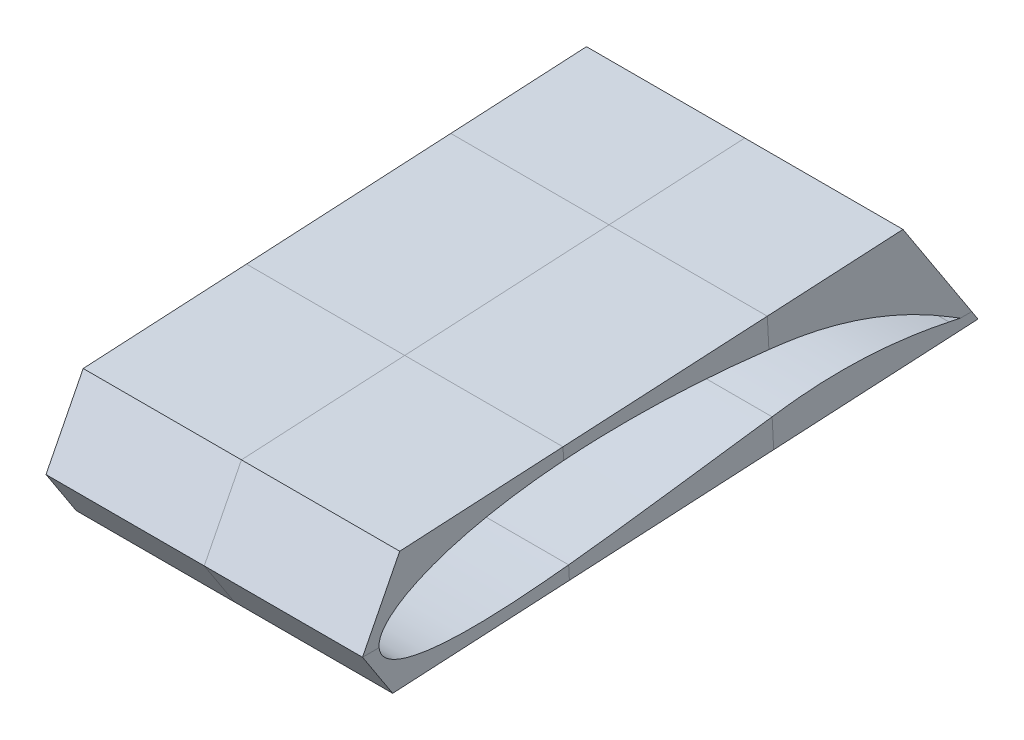
from build123d import *

# Parameters (mm, degrees)
BOSS_EXTRUDE1_DEPTH = 307.975
SPLIT1_START        = -485.775
SPLIT1_DEPTH        = 153.9875
SPLIT1_2_DEPTH      = 307.975
SPLIT1_3_DEPTH      = 153.9875
SPLIT1_START_2      = -331.7875
SPLIT1_4_DEPTH      = 153.9875
SPLIT1_5_DEPTH      = 153.9875
SPLIT1_6_DEPTH      = 153.9875
SPLIT1_7_DEPTH      = 153.9875
SPLIT1_8_DEPTH      = 153.9875
SPLIT1_9_DEPTH      = 153.9875
SPLIT1_10_DEPTH     = 153.9875
SPLIT1_11_DEPTH     = 153.9875
SPLIT1_12_DEPTH     = 153.9875
SPLIT1_13_DEPTH     = 153.9875


# Read off the part's stored shape, not the designer's step: Split1
with BuildPart() as part:
    # Sketch1 → Boss-Extrude1 (new body)
    with BuildSketch(Plane(origin=(-177.8, 0, 0), x_dir=(0, 0, -1), z_dir=(1, 0, 0))):
        Polygon((513.02494952, -19.851775639), (-56.509600677, -50.472242358), (-85.881394641, -5.377282109), (-49.696241189, 65.878150842), (440.036717188, 92.208163215), align=None)
        with BuildLine():
            Line((484.839703056, -8.192197373), (495.8122137, -10.532748432))
            Line((495.8122137, -10.532748432), (486.265240326, -4.635043727))
            add(Edge.make_bspline(
                [(486.265240326, -4.635043727), (475.79860462, 1.830788345), (454.312764269, 13.889269748), (420.690900196, 29.224509239), (391.639559872, 39.466297596), (367.90681192, 46.038347186), (349.897665028, 50.128971617), (331.712828112, 53.395898866), (313.408651411, 55.714700607), (295.107197371, 57.867272502), (270.654519927, 60.351467104), (240.02755424, 62.792086284), (203.195919164, 64.551841288), (166.320848878, 65.028496228), (129.448182964, 64.061858785), (92.64737896, 61.427213177), (62.127891062, 57.590313265), (37.896239171, 53.299755101), (19.852790085, 49.385506886), (1.994982658, 44.66024218), (-12.661714378, 39.910938035), (-24.174367926, 35.489238489), (-32.668724275, 31.808428386), (-40.974488962, 27.691854794), (-49.012685713, 23.031932392), (-56.633939597, 17.658079271), (-62.404116233, 12.345324832), (-66.27011402, 7.327354834), (-68.571498001, 3.099417508), (-69.561010993, -0.452354777), (-69.791797127, -2.884453105), (-69.817628559, -4.125270626), (-69.719695431, -5.366591547), (-69.617591835, -6.130019587), (-69.566361774, -6.519139071)],
                knots=[0, 0, 0, 0, 0.062504124, 0.125008247, 0.187512371, 0.218764432, 0.250016494, 0.281268556, 0.312520618, 0.343772679, 0.375024741, 0.437528865, 0.500032988, 0.562537112, 0.625041235, 0.687545359, 0.750049482, 0.781301544, 0.812553606, 0.843805668, 0.87505773, 0.89068376, 0.906309791, 0.921935822, 0.937561853, 0.953187884, 0.968813915, 0.97662693, 0.984439946, 0.992252961, 0.994206215, 0.996159469, 0.998112723, 1.000065977, 1.000065977, 1.000065977, 1.000065977], degree=3))
            add(Edge.make_bspline(
                [(-69.566361774, -6.519139071), (-69.488391083, -6.887212733), (-69.336376013, -7.610527586), (-69.035422589, -8.761843268), (-68.626070204, -9.882594068), (-67.661985103, -12.02122893), (-65.692313013, -14.954602026), (-62.34121882, -18.137449476), (-57.338218927, -21.596487635), (-50.522049924, -24.79036297), (-42.005913899, -27.535977551), (-33.324040008, -29.551342566), (-21.635201556, -31.532992145), (-6.913441025, -33.018600841), (10.797287334, -33.77654236), (28.509731195, -33.795049142), (46.204386524, -33.258608838), (69.764194558, -31.966919449), (99.146019739, -29.503407621), (134.308212308, -25.693371562), (169.399514795, -21.349054953), (204.44646442, -16.703884826), (239.471434512, -11.928812283), (268.654643905, -7.939420679), (292.007732636, -4.791722901), (306.600292673, -2.837801001), (318.28899772, -1.309074367), (329.949567815, 0.263068832), (344.57029527, 1.719295513), (362.175990442, 2.805066666), (385.687405297, 3.31793184), (415.082460118, 2.25388388), (444.321872592, -0.96022194), (467.54212674, -4.727772579), (479.089279042, -6.965571904), (484.839703056, -8.192197373)],
                knots=[-6.8756e-05, -6.8756e-05, -6.8756e-05, -6.8756e-05, 0.001884504, 0.003837763, 0.005791022, 0.007744282, 0.015557319, 0.023370356, 0.031183393, 0.046809467, 0.062435542, 0.078061616, 0.09368769, 0.124939839, 0.156191987, 0.187444136, 0.218696285, 0.249948433, 0.312452731, 0.374957028, 0.437461325, 0.499965622, 0.562469919, 0.624974217, 0.656226365, 0.687478514, 0.703104588, 0.718730662, 0.749982811, 0.78123496, 0.812487108, 0.874991406, 0.937495703, 0.968747851, 1, 1, 1, 1], degree=3))
        make_face(mode=Mode.SUBTRACT)
    extrude(amount=-BOSS_EXTRUDE1_DEPTH)

    # Split1 2 outline → Split1 2 (cut)
    with BuildSketch(Plane.YZ.offset(SPLIT1_START)):
        with BuildLine():
            Line((-19.851775639, -513.02494952), (-10.532748431, -506.955168206))
            Line((-10.532748431, -506.955168206), (-10.532748432, -495.8122137))
            Line((-10.532748432, -495.8122137), (-8.192197373, -484.839703056))
            add(Edge.make_bspline(
                [(-6.519139071, 69.566361774), (-6.887212733, 69.488391083), (-7.610527586, 69.336376013), (-8.761843268, 69.035422589), (-9.882594068, 68.626070204), (-12.02122893, 67.661985103), (-14.954602026, 65.692313013), (-18.137449476, 62.34121882), (-21.596487635, 57.338218927), (-24.79036297, 50.522049924), (-27.535977551, 42.005913899), (-29.551342566, 33.324040008), (-31.532992145, 21.635201556), (-33.018600841, 6.913441025), (-33.77654236, -10.797287334), (-33.795049142, -28.509731195), (-33.258608838, -46.204386524), (-31.966919449, -69.764194558), (-29.503407621, -99.146019739), (-25.693371562, -134.308212308), (-21.349054953, -169.399514795), (-16.703884826, -204.44646442), (-11.928812283, -239.471434512), (-7.939420679, -268.654643905), (-4.791722901, -292.007732636), (-2.837801001, -306.600292673), (-1.309074367, -318.28899772), (0.263068832, -329.949567815), (1.719295513, -344.57029527), (2.805066666, -362.175990442), (3.31793184, -385.687405297), (2.25388388, -415.082460118), (-0.96022194, -444.321872592), (-4.727772579, -467.54212674), (-6.965571904, -479.089279042), (-8.192197373, -484.839703056)],
                knots=[-6.8756e-05, -6.8756e-05, -6.8756e-05, -6.8756e-05, 0.001884504, 0.003837763, 0.005791022, 0.007744282, 0.015557319, 0.023370356, 0.031183393, 0.046809467, 0.062435542, 0.078061616, 0.09368769, 0.124939839, 0.156191987, 0.187444136, 0.218696285, 0.249948433, 0.312452731, 0.374957028, 0.437461325, 0.499965622, 0.562469919, 0.624974217, 0.656226365, 0.687478514, 0.703104588, 0.718730662, 0.749982811, 0.78123496, 0.812487108, 0.874991406, 0.937495703, 0.968747851, 1, 1, 1, 1], degree=3))
            add(Edge.make_bspline(
                [(56.152986063, -309.562582286), (56.731683742, -304.743730709), (57.997792096, -293.822453609), (60.351467104, -270.654519927), (62.792086284, -240.02755424), (64.551841288, -203.195919164), (65.028496228, -166.320848878), (64.061858785, -129.448182964), (61.427213177, -92.64737896), (57.590313265, -62.127891062), (53.299755101, -37.896239171), (49.385506886, -19.852790085), (44.66024218, -1.994982658), (39.910938035, 12.661714378), (35.489238489, 24.174367926), (31.808428386, 32.668724275), (27.691854794, 40.974488962), (23.031932392, 49.012685713), (17.658079271, 56.633939597), (12.345324832, 62.404116233), (7.327354834, 66.27011402), (3.099417508, 68.571498001), (-0.452354777, 69.561010993), (-2.884453105, 69.791797127), (-4.125270626, 69.817628559), (-5.366591547, 69.719695431), (-6.130019587, 69.617591835), (-6.519139071, 69.566361774)],
                knots=[0.319088551, 0.319088551, 0.319088551, 0.319088551, 0.343772679, 0.375024741, 0.437528865, 0.500032988, 0.562537112, 0.625041235, 0.687545359, 0.750049482, 0.781301544, 0.812553606, 0.843805668, 0.87505773, 0.89068376, 0.906309791, 0.921935822, 0.937561853, 0.953187884, 0.968813915, 0.97662693, 0.984439946, 0.992252961, 0.994206215, 0.996159469, 0.998112723, 1.000065977, 1.000065977, 1.000065977, 1.000065977], degree=3))
            Line((56.152986063, -309.562582286), (85.109648016, -308.005755745))
            Line((85.109648016, -308.005755745), (65.878150842, 49.696241189))
            Line((65.878150842, 49.696241189), (-5.377282109, 85.881394641))
            Line((-5.377282109, 85.881394641), (-50.472242358, 56.509600677))
            Line((-50.472242358, 56.509600677), (-19.851775639, -513.02494952))
        make_face()
    extrude(amount=SPLIT1_2_DEPTH, mode=Mode.SUBTRACT)

    # Split1 3 outline → Split1 3 (cut)
    with BuildSketch(Plane.YZ.offset(SPLIT1_START)):
        with BuildLine():
            Line((-10.532748432, -495.8122137), (-10.532748432, -506.955168205))
            Line((-10.532748432, -506.955168205), (92.208163215, -440.036717188))
            Line((92.208163215, -440.036717188), (85.109648016, -308.005755745))
            Line((85.109648016, -308.005755745), (56.152986063, -309.562582286))
            add(Edge.make_bspline(
                [(-4.635043727, -486.265240326), (1.830788345, -475.79860462), (13.889269748, -454.312764269), (29.224509239, -420.690900196), (39.466297596, -391.639559872), (46.038347186, -367.90681192), (50.128971617, -349.897665028), (53.395898866, -331.712828112), (55.104206496, -318.227774964), (55.99900663, -310.8447786), (56.152986063, -309.562582286)],
                knots=[0, 0, 0, 0, 0.062504124, 0.125008247, 0.187512371, 0.218764432, 0.250016494, 0.281268556, 0.312520618, 0.319088551, 0.319088551, 0.319088551, 0.319088551], degree=3))
            Line((-4.635043727, -486.265240326), (-10.532748432, -495.8122137))
        make_face()
    extrude(amount=SPLIT1_3_DEPTH, mode=Mode.SUBTRACT)


with BuildPart() as body_2:
    # Split1 outline → Split1 (new body)
    with BuildSketch(Plane.YZ.offset(SPLIT1_START)):
        with BuildLine():
            add(Edge.make_bspline(
                [(56.152986063, -309.562582286), (56.731683742, -304.743730709), (57.997792096, -293.822453609), (60.351467104, -270.654519927), (62.792086284, -240.02755424), (64.551841288, -203.195919164), (65.028496228, -166.320848878), (64.212349164, -135.188682185), (63.065132011, -116.375549157), (62.579717542, -109.841009626)],
                knots=[0.319088551, 0.319088551, 0.319088551, 0.319088551, 0.343772679, 0.375024741, 0.437528865, 0.500032988, 0.562537112, 0.625041235, 0.658352606, 0.658352606, 0.658352606, 0.658352606], degree=3))
            Line((56.152986063, -309.562582286), (85.109648016, -308.005755745))
            Line((85.109648016, -308.005755745), (74.421285843, -109.204359323))
            Line((74.421285843, -109.204359323), (62.579717542, -109.841009626))
        make_face()
    extrude(amount=SPLIT1_DEPTH)


with BuildPart() as body_3:
    # Split1 4 outline → Split1 4 (new body)
    with BuildSketch(Plane.YZ.offset(SPLIT1_START_2)):
        with BuildLine():
            Line((-2.041680646, -312.691361488), (-30.540137813, -314.223553097))
            Line((-30.540137813, -314.223553097), (-19.851775639, -513.02494952))
            Line((-19.851775639, -513.02494952), (-10.532748432, -506.955168205))
            Line((-10.532748432, -506.955168205), (-10.532748432, -495.8122137))
            Line((-10.532748432, -495.8122137), (-8.192197373, -484.839703056))
            add(Edge.make_bspline(
                [(-2.041680646, -312.691361488), (-1.796442631, -314.556679466), (-1.167008044, -319.342702191), (0.263068832, -329.949567815), (1.719295513, -344.57029527), (2.805066666, -362.175990442), (3.31793184, -385.687405297), (2.25388388, -415.082460118), (-0.96022194, -444.321872592), (-4.727772579, -467.54212674), (-6.965571904, -479.089279042), (-8.192197373, -484.839703056)],
                knots=[0.693126699, 0.693126699, 0.693126699, 0.693126699, 0.703104588, 0.718730662, 0.749982811, 0.78123496, 0.812487108, 0.874991406, 0.937495703, 0.968747851, 1, 1, 1, 1], degree=3))
        make_face()
    extrude(amount=SPLIT1_4_DEPTH)


with BuildPart() as body_4:
    # Split1 5 outline → Split1 5 (new body)
    with BuildSketch(Plane.YZ.offset(SPLIT1_START)):
        with BuildLine():
            Line((-10.532748432, -495.8122137), (-10.532748432, -506.955168205))
            Line((-10.532748432, -506.955168205), (92.208163215, -440.036717188))
            Line((92.208163215, -440.036717188), (85.109648016, -308.005755745))
            Line((85.109648016, -308.005755745), (56.152986063, -309.562582286))
            add(Edge.make_bspline(
                [(-4.635043727, -486.265240326), (1.830788345, -475.79860462), (13.889269748, -454.312764269), (29.224509239, -420.690900196), (39.466297596, -391.639559872), (46.038347186, -367.90681192), (50.128971617, -349.897665028), (53.395898866, -331.712828112), (55.104206496, -318.227774964), (55.99900663, -310.8447786), (56.152986063, -309.562582286)],
                knots=[0, 0, 0, 0, 0.062504124, 0.125008247, 0.187512371, 0.218764432, 0.250016494, 0.281268556, 0.312520618, 0.319088551, 0.319088551, 0.319088551, 0.319088551], degree=3))
            Line((-4.635043727, -486.265240326), (-10.532748432, -495.8122137))
        make_face()
    extrude(amount=SPLIT1_5_DEPTH)


with BuildPart() as body_5:
    # Split1 6 outline → Split1 6 (new body)
    with BuildSketch(Plane.YZ.offset(SPLIT1_START_2)):
        with BuildLine():
            Line((-41.228499986, -115.422156675), (-27.785316045, -114.699397075))
            add(Edge.make_bspline(
                [(-6.519139071, 69.566361774), (-6.887212733, 69.488391083), (-7.610527586, 69.336376013), (-8.761843268, 69.035422589), (-9.882594068, 68.626070204), (-12.02122893, 67.661985103), (-14.954602026, 65.692313013), (-18.137449476, 62.34121882), (-21.596487635, 57.338218927), (-24.79036297, 50.522049924), (-27.535977551, 42.005913899), (-29.551342566, 33.324040008), (-31.532992145, 21.635201556), (-33.018600841, 6.913441025), (-33.77654236, -10.797287334), (-33.795049142, -28.509731195), (-33.258608838, -46.204386524), (-31.966919449, -69.764194558), (-30.052829509, -92.593172025), (-28.335360098, -109.512495123), (-27.785316045, -114.699397075)],
                knots=[-6.8756e-05, -6.8756e-05, -6.8756e-05, -6.8756e-05, 0.001884504, 0.003837763, 0.005791022, 0.007744282, 0.015557319, 0.023370356, 0.031183393, 0.046809467, 0.062435542, 0.078061616, 0.09368769, 0.124939839, 0.156191987, 0.187444136, 0.218696285, 0.249948433, 0.312452731, 0.340107156, 0.340107156, 0.340107156, 0.340107156], degree=3))
            add(Edge.make_bspline(
                [(-5.377282109, 69.707664089), (-5.765420236, 69.666355064), (-6.138741042, 69.6164436), (-6.519139071, 69.566361774)],
                knots=[0.998156502, 0.998156502, 0.998156502, 0.998156502, 1.000065977, 1.000065977, 1.000065977, 1.000065977], degree=3))
            Line((-5.377282109, 69.707664089), (-5.377282109, 85.881394641))
            Line((-5.377282109, 85.881394641), (-50.472242358, 56.509600677))
            Line((-50.472242358, 56.509600677), (-41.228499986, -115.422156675))
        make_face()
    extrude(amount=SPLIT1_6_DEPTH)


with BuildPart() as body_6:
    # Split1 7 outline → Split1 7 (new body)
    with BuildSketch(Plane.YZ.offset(SPLIT1_START_2)):
        with BuildLine():
            Line((-41.228499986, -115.422156675), (-30.540137813, -314.223553097))
            Line((-30.540137813, -314.223553097), (-2.041680645, -312.691361494))
            add(Edge.make_bspline(
                [(-27.785316045, -114.69939707), (-27.092155187, -121.235886988), (-25.052671199, -139.483482041), (-21.349054953, -169.399514795), (-16.703884826, -204.44646442), (-11.928812283, -239.471434512), (-7.939420679, -268.654643905), (-4.791722901, -292.007732636), (-3.087332854, -304.736703069), (-2.180502559, -311.635460711), (-2.041680645, -312.691361494)],
                knots=[0.340107156, 0.340107156, 0.340107156, 0.340107156, 0.374957028, 0.437461325, 0.499965622, 0.562469919, 0.624974217, 0.656226365, 0.687478514, 0.693126699, 0.693126699, 0.693126699, 0.693126699], degree=3))
            Line((-27.785316045, -114.69939707), (-41.228499986, -115.422156675))
        make_face()
    extrude(amount=SPLIT1_7_DEPTH)


with BuildPart() as body_7:
    # Split1 8 outline → Split1 8 (new body)
    with BuildSketch(Plane.YZ.offset(SPLIT1_START)):
        with BuildLine():
            Line((-41.228499986, -115.422156675), (-27.785316045, -114.699397075))
            add(Edge.make_bspline(
                [(-6.519139071, 69.566361774), (-6.887212733, 69.488391083), (-7.610527586, 69.336376013), (-8.761843268, 69.035422589), (-9.882594068, 68.626070204), (-12.02122893, 67.661985103), (-14.954602026, 65.692313013), (-18.137449476, 62.34121882), (-21.596487635, 57.338218927), (-24.79036297, 50.522049924), (-27.535977551, 42.005913899), (-29.551342566, 33.324040008), (-31.532992145, 21.635201556), (-33.018600841, 6.913441025), (-33.77654236, -10.797287334), (-33.795049142, -28.509731195), (-33.258608838, -46.204386524), (-31.966919449, -69.764194558), (-30.052829509, -92.593172025), (-28.335360098, -109.512495123), (-27.785316045, -114.699397075)],
                knots=[-6.8756e-05, -6.8756e-05, -6.8756e-05, -6.8756e-05, 0.001884504, 0.003837763, 0.005791022, 0.007744282, 0.015557319, 0.023370356, 0.031183393, 0.046809467, 0.062435542, 0.078061616, 0.09368769, 0.124939839, 0.156191987, 0.187444136, 0.218696285, 0.249948433, 0.312452731, 0.340107156, 0.340107156, 0.340107156, 0.340107156], degree=3))
            add(Edge.make_bspline(
                [(-5.377282109, 69.707664089), (-5.765420236, 69.666355064), (-6.138741042, 69.6164436), (-6.519139071, 69.566361774)],
                knots=[0.998156502, 0.998156502, 0.998156502, 0.998156502, 1.000065977, 1.000065977, 1.000065977, 1.000065977], degree=3))
            Line((-5.377282109, 69.707664089), (-5.377282109, 85.881394641))
            Line((-5.377282109, 85.881394641), (-50.472242358, 56.509600677))
            Line((-50.472242358, 56.509600677), (-41.228499986, -115.422156675))
        make_face()
    extrude(amount=SPLIT1_8_DEPTH)


with BuildPart() as body_8:
    # Split1 9 outline → Split1 9 (new body)
    with BuildSketch(Plane.YZ.offset(SPLIT1_START)):
        with BuildLine():
            Line((-2.041680646, -312.691361488), (-30.540137813, -314.223553097))
            Line((-30.540137813, -314.223553097), (-19.851775639, -513.02494952))
            Line((-19.851775639, -513.02494952), (-10.532748432, -506.955168205))
            Line((-10.532748432, -506.955168205), (-10.532748432, -495.8122137))
            Line((-10.532748432, -495.8122137), (-8.192197373, -484.839703056))
            add(Edge.make_bspline(
                [(-2.041680646, -312.691361488), (-1.796442631, -314.556679466), (-1.167008044, -319.342702191), (0.263068832, -329.949567815), (1.719295513, -344.57029527), (2.805066666, -362.175990442), (3.31793184, -385.687405297), (2.25388388, -415.082460118), (-0.96022194, -444.321872592), (-4.727772579, -467.54212674), (-6.965571904, -479.089279042), (-8.192197373, -484.839703056)],
                knots=[0.693126699, 0.693126699, 0.693126699, 0.693126699, 0.703104588, 0.718730662, 0.749982811, 0.78123496, 0.812487108, 0.874991406, 0.937495703, 0.968747851, 1, 1, 1, 1], degree=3))
        make_face()
    extrude(amount=SPLIT1_9_DEPTH)


with BuildPart() as body_9:
    # Split1 10 outline → Split1 10 (new body)
    with BuildSketch(Plane.YZ.offset(SPLIT1_START_2)):
        with BuildLine():
            Line((62.579717543, -109.841009633), (74.421285843, -109.204359323))
            Line((74.421285843, -109.204359323), (65.878150842, 49.696241189))
            Line((65.878150842, 49.696241189), (-5.377282109, 85.881394641))
            Line((-5.377282109, 85.881394641), (-5.377282109, 69.707664089))
            add(Edge.make_bspline(
                [(62.579717543, -109.841009633), (62.154319722, -104.114400614), (60.609267809, -86.141273947), (57.590313265, -62.127891062), (53.299755101, -37.896239171), (49.385506886, -19.852790085), (44.66024218, -1.994982658), (39.910938035, 12.661714378), (35.489238489, 24.174367926), (31.808428386, 32.668724275), (27.691854794, 40.974488962), (23.031932392, 49.012685713), (17.658079271, 56.633939597), (12.345324832, 62.404116233), (7.327354834, 66.27011402), (3.099417508, 68.571498001), (-0.452354777, 69.561010993), (-2.884453105, 69.791797127), (-4.125270626, 69.817628559), (-4.962091943, 69.751608139), (-5.368383195, 69.708611188), (-5.377282109, 69.707664089)],
                knots=[0.658352606, 0.658352606, 0.658352606, 0.658352606, 0.687545359, 0.750049482, 0.781301544, 0.812553606, 0.843805668, 0.87505773, 0.89068376, 0.906309791, 0.921935822, 0.937561853, 0.953187884, 0.968813915, 0.97662693, 0.984439946, 0.992252961, 0.994206215, 0.996159469, 0.998112723, 0.998156502, 0.998156502, 0.998156502, 0.998156502], degree=3))
        make_face()
    extrude(amount=SPLIT1_10_DEPTH)


with BuildPart() as body_10:
    # Split1 11 outline → Split1 11 (new body)
    with BuildSketch(Plane.YZ.offset(SPLIT1_START_2)):
        with BuildLine():
            add(Edge.make_bspline(
                [(56.152986063, -309.562582286), (56.731683742, -304.743730709), (57.997792096, -293.822453609), (60.351467104, -270.654519927), (62.792086284, -240.02755424), (64.551841288, -203.195919164), (65.028496228, -166.320848878), (64.212349164, -135.188682185), (63.065132011, -116.375549157), (62.579717542, -109.841009626)],
                knots=[0.319088551, 0.319088551, 0.319088551, 0.319088551, 0.343772679, 0.375024741, 0.437528865, 0.500032988, 0.562537112, 0.625041235, 0.658352606, 0.658352606, 0.658352606, 0.658352606], degree=3))
            Line((56.152986063, -309.562582286), (85.109648016, -308.005755745))
            Line((85.109648016, -308.005755745), (74.421285843, -109.204359323))
            Line((74.421285843, -109.204359323), (62.579717542, -109.841009626))
        make_face()
    extrude(amount=SPLIT1_11_DEPTH)


with BuildPart() as body_11:
    # Split1 12 outline → Split1 12 (new body)
    with BuildSketch(Plane.YZ.offset(SPLIT1_START)):
        with BuildLine():
            Line((62.579717543, -109.841009633), (74.421285843, -109.204359323))
            Line((74.421285843, -109.204359323), (65.878150842, 49.696241189))
            Line((65.878150842, 49.696241189), (-5.377282109, 85.881394641))
            Line((-5.377282109, 85.881394641), (-5.377282109, 69.707664089))
            add(Edge.make_bspline(
                [(62.579717543, -109.841009633), (62.154319722, -104.114400614), (60.609267809, -86.141273947), (57.590313265, -62.127891062), (53.299755101, -37.896239171), (49.385506886, -19.852790085), (44.66024218, -1.994982658), (39.910938035, 12.661714378), (35.489238489, 24.174367926), (31.808428386, 32.668724275), (27.691854794, 40.974488962), (23.031932392, 49.012685713), (17.658079271, 56.633939597), (12.345324832, 62.404116233), (7.327354834, 66.27011402), (3.099417508, 68.571498001), (-0.452354777, 69.561010993), (-2.884453105, 69.791797127), (-4.125270626, 69.817628559), (-4.962091943, 69.751608139), (-5.368383195, 69.708611188), (-5.377282109, 69.707664089)],
                knots=[0.658352606, 0.658352606, 0.658352606, 0.658352606, 0.687545359, 0.750049482, 0.781301544, 0.812553606, 0.843805668, 0.87505773, 0.89068376, 0.906309791, 0.921935822, 0.937561853, 0.953187884, 0.968813915, 0.97662693, 0.984439946, 0.992252961, 0.994206215, 0.996159469, 0.998112723, 0.998156502, 0.998156502, 0.998156502, 0.998156502], degree=3))
        make_face()
    extrude(amount=SPLIT1_12_DEPTH)


with BuildPart() as body_12:
    # Split1 13 outline → Split1 13 (new body)
    with BuildSketch(Plane.YZ.offset(SPLIT1_START)):
        with BuildLine():
            Line((-41.228499986, -115.422156675), (-30.540137813, -314.223553097))
            Line((-30.540137813, -314.223553097), (-2.041680645, -312.691361494))
            add(Edge.make_bspline(
                [(-27.785316045, -114.69939707), (-27.092155187, -121.235886988), (-25.052671199, -139.483482041), (-21.349054953, -169.399514795), (-16.703884826, -204.44646442), (-11.928812283, -239.471434512), (-7.939420679, -268.654643905), (-4.791722901, -292.007732636), (-3.087332854, -304.736703069), (-2.180502559, -311.635460711), (-2.041680645, -312.691361494)],
                knots=[0.340107156, 0.340107156, 0.340107156, 0.340107156, 0.374957028, 0.437461325, 0.499965622, 0.562469919, 0.624974217, 0.656226365, 0.687478514, 0.693126699, 0.693126699, 0.693126699, 0.693126699], degree=3))
            Line((-27.785316045, -114.69939707), (-41.228499986, -115.422156675))
        make_face()
    extrude(amount=SPLIT1_13_DEPTH)


solid = Compound([part.part, body_2.part, body_3.part, body_4.part, body_5.part, body_6.part, body_7.part, body_8.part, body_9.part, body_10.part, body_11.part, body_12.part])
